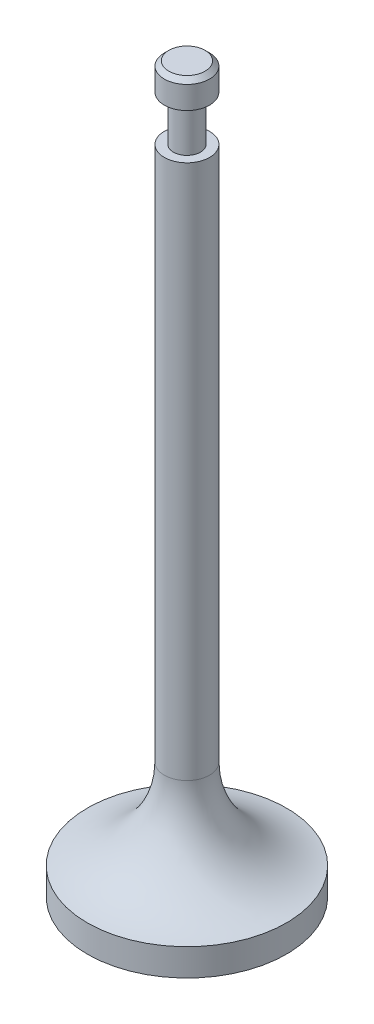
from build123d import *

# Parameters (mm, degrees)
CHAMFER1_SIZE = 0.5
FILLET1_R     = 10


with BuildPart() as part:
    # Sketch1 → Revolve1 (revolve)
    with BuildSketch(Plane(origin=(0, 0, 0), x_dir=(0, 0, -1), z_dir=(1, 0, 0)), mode=Mode.PRIVATE) as revolve1_sk:
        Polygon((0, 0), (0, -80), (11.00000000000001, -80), (11.00000000000001, -77), (2.5000000000000098, -77), (2.5000000000000098, -8), (1.4957064412197685, -8), (1.4957064412197685, -3.000000000000001), (2.500000000000019, -3.000000000000001), (2.500000000000019, -4e-16), align=None)
    revolve(revolve1_sk.sketch.rotate(Axis((0, 0, 0), (0, -1, 0)), 180), axis=Axis((0, 0, 0), (0, -1, 0)))

    # Chamfer1
    chamfer1_edges = [part.edges().sort_by_distance(p)[0] for p in [
        (-6.1e-16, -4e-16, -2.500000000000019),
    ]]
    chamfer(chamfer1_edges, length=CHAMFER1_SIZE)

    # Fillet1
    # the kernel refuses this fillet: 10 mm, written as the material it adds along each edge
    with BuildSketch(Plane(origin=(0, -77, 0), x_dir=(1.2e-16, 0, 1), z_dir=(1, 0, -1.2e-16))) as fillet1_piece_1:
        with BuildLine():
            CenterArc((12.500000000000007, -9.886859966642888), FILLET1_R, 98.62692655867836, 81.37307344132165)
            Line((11.000000000000053, -2.8422e-13), (10.970000000000054, 0.19773719933256473))
            ThreePointArc((10.970000000000054, 0.19773719933256473), (6.750000000000032, 0.20000000000000284), (2.5000000000000098, 0.20000000000000284))
            Line((2.5000000000000098, 0.20000000000000284), (2.3000000000000096, 0))
            Line((2.3000000000000096, 0), (2.300000000000007, -9.886859966642888))
            Line((2.300000000000007, -9.886859966642888), (2.500000000000007, -9.886859966642888))
        make_face()
    revolve(axis=Axis((0, -77, 0), (0, -1, 0)))


solid = part.part
